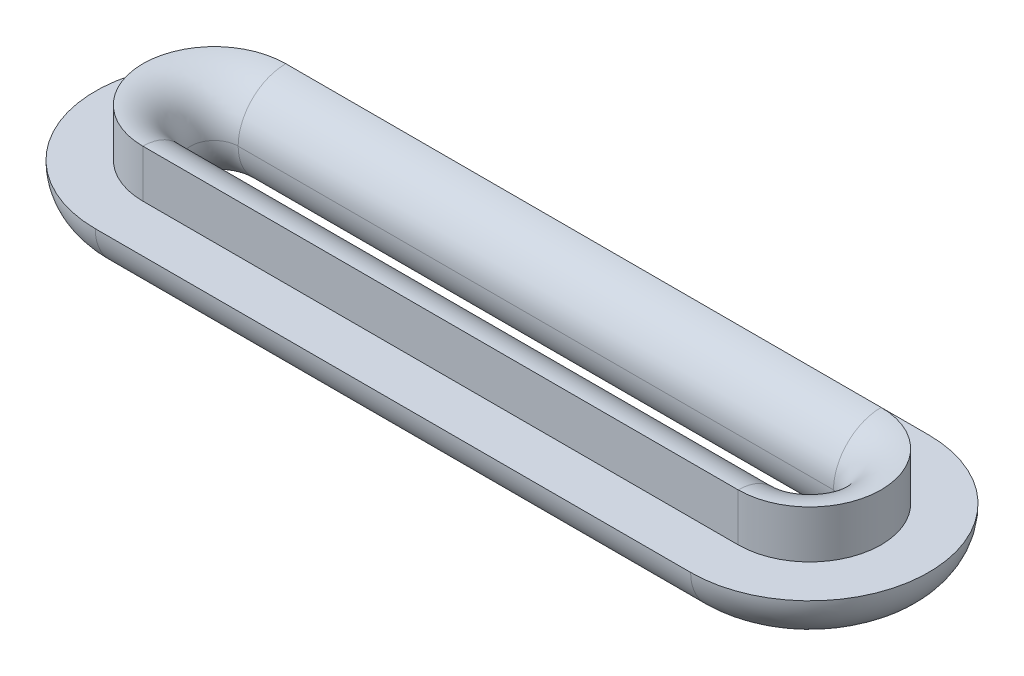
from build123d import *

# Parameters (mm, degrees)
EXTRUDE_THIN1_DEPTH = 2
FILLET1_R           = 2
BOSS_EXTRUDE1_START = 2
BOSS_EXTRUDE1_DEPTH = 2
FILLET2_R           = 2


with BuildPart() as part:
    # Sketch1 → Extrude-Thin1 (new body)
    with BuildSketch(Plane(origin=(0, 0, 0), x_dir=(1, 0, 0), z_dir=(0, 1, 0))):
        with BuildLine():
            Line((12.5, -3), (-12.5, -3))
            ThreePointArc((-12.5, -3), (-15.5, 0), (-12.5, 3))
            Line((-12.5, 3), (12.5, 3))
            ThreePointArc((12.5, 3), (15.5, 0), (12.5, -3))
        make_face()
        with BuildLine():
            Line((12.5, -1), (-12.5, -1))
            ThreePointArc((-12.5, -1), (-13.5, 0), (-12.5, 1))
            Line((-12.5, 1), (12.5, 1))
            ThreePointArc((12.5, 1), (13.5, 0), (12.5, -1))
        make_face(mode=Mode.SUBTRACT)
    extrude(amount=EXTRUDE_THIN1_DEPTH)

    # Fillet1
    fillet1_edges = [part.edges().sort_by_distance(p)[0] for p in [
        (13.5, 2, 0),
        (0, 2, 1),
        (-13.5, 2, 0),
        (0, 2, -1),
    ]]
    fillet(fillet1_edges, radius=FILLET1_R - 0.0001)  # a hair under: the kernel refuses the full size

    # Sketch2 → Boss-Extrude1 (add)
    with BuildSketch(Plane.XZ.offset(BOSS_EXTRUDE1_START)):
        with BuildLine():
            Line((12.5, -5), (-12.5, -5))
            ThreePointArc((-12.5, -5), (-17.5, 0), (-12.5, 5))
            Line((-12.5, 5), (12.5, 5))
            ThreePointArc((12.5, 5), (17.5, 0), (12.5, -5))
        make_face()
        with BuildLine():
            Line((12.5, -1), (-12.5, -1))
            ThreePointArc((-12.5, -1), (-13.5, 0), (-12.5, 1))
            Line((-12.5, 1), (12.5, 1))
            ThreePointArc((12.5, 1), (13.5, 0), (12.5, -1))
        make_face(mode=Mode.SUBTRACT)
    extrude(amount=-BOSS_EXTRUDE1_DEPTH)

    # Fillet2
    fillet2_edges = [part.edges().sort_by_distance(p)[0] for p in [
        (-13.5, -2, 0),
        (0, -2, -1),
        (13.5, -2, 0),
        (0, -2, 1),
        (0, -2, -5),
        (-17.5, -2, 0),
        (0, -2, 5),
        (17.5, -2, 0),
    ]]
    fillet(fillet2_edges, radius=FILLET2_R - 0.0001)  # a hair under: the kernel refuses the full size


solid = part.part
